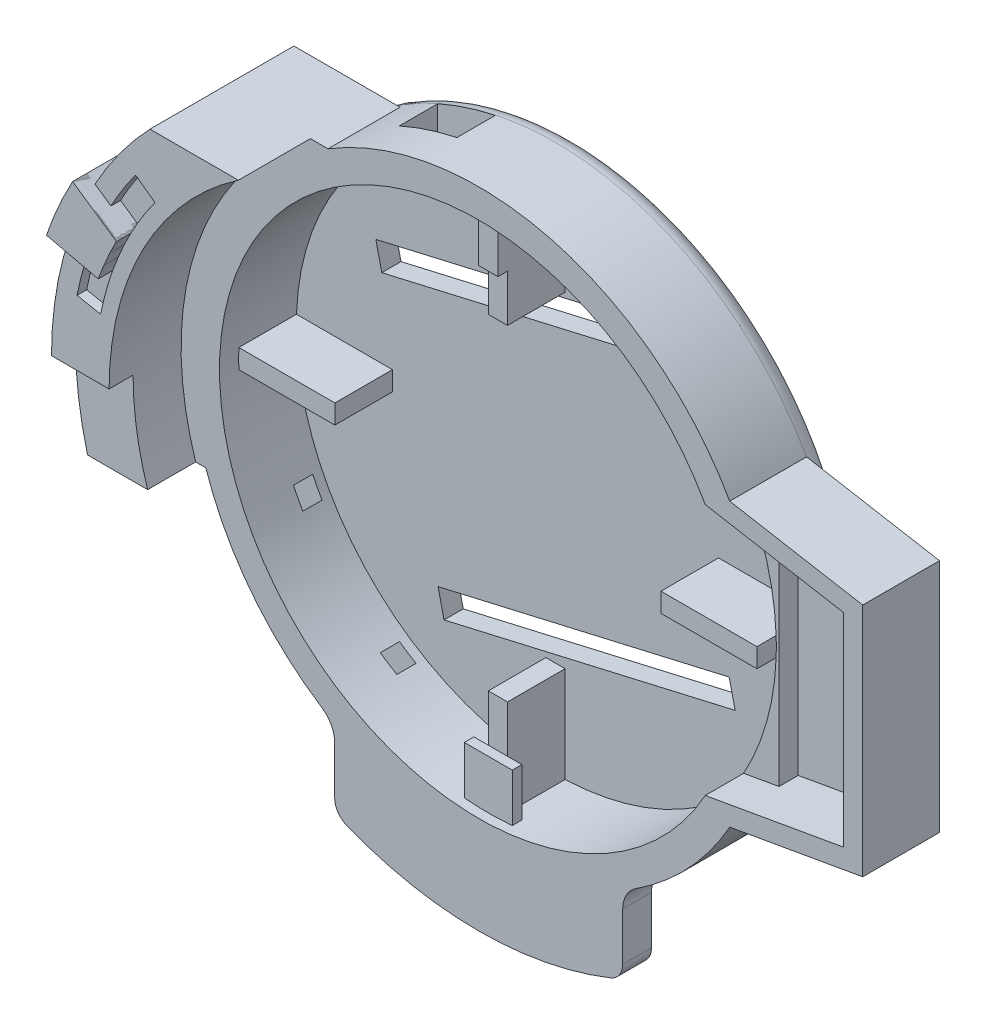
from build123d import *

# Parameters (mm, degrees)
SKETCH_1_R           = 30
EXTRUDE_1_DEPTH      = 2
SKETCH_5_R           = 30
SKETCH_5_R_2         = 27
EXTRUDE_2_DEPTH      = 10
EXTRUDE_START        = -3
EXTRUDE_3_DEPTH      = 3
FILLET_2_R           = 3
FILLET_3_R           = 3
EXTRUDE_START_2      = -6
EXTRUDE_4_DEPTH      = 6
EXTRUDE_6_DEPTH      = 7.5
SKETCH_14_R          = 31
CUT_EXTRUDE_3_DEPTH  = 7.5
CHAMFER_4_SIZE       = 2.644904711
CHAMFER_4_SIZE_2     = 15
CHAMFER_5_SIZE       = 2.644904711
CHAMFER_5_SIZE_2     = 15
CUT_EXTRUDE_START    = -4
CUT_EXTRUDE_6_DEPTH  = 4
EXTRUDE_10_DEPTH     = 5
CUT_EXTRUDE_START_2  = 6
CUT_EXTRUDE_7_DEPTH  = 6
EXTRUDE_11_DEPTH     = 8
EXTRUDE_12_DEPTH     = 1
EXTRUDE_13_DEPTH     = 1.5
EXTRUDE_14_DEPTH     = 16.5
CUT_EXTRUDE_START_3  = -1
CUT_EXTRUDE_8_DEPTH  = 1
EXTRUDE_START_3      = 2
EXTRUDE_15_DEPTH     = 2
CUT_EXTRUDE_9_DEPTH  = 2
SKETCH_33_R          = 30
CUT_EXTRUDE_10_DEPTH = 2
SKETCH_34_R          = 30
EXTRUDE_16_DEPTH     = 2
FILLET_4_R           = 2
FILLET_5_R           = 2
CUT_EXTRUDE_11_DEPTH = 10
FILLET_6_R           = 2
SKETCH_37_W          = 2
SKETCH_37_H          = 2
CUT_EXTRUDE_12_DEPTH = 65
SKETCH_38_W          = 6
SKETCH_38_H          = 4
CUT_EXTRUDE_14_DEPTH = 45


# Some blends are built 0.0001 mm under size
with BuildPart() as part:
    # 草图1 → 凸台-拉伸1 (new body)
    with BuildSketch(Plane.XY):
        Circle(SKETCH_1_R)
    extrude(amount=EXTRUDE_1_DEPTH)

    # 草图5 → 凸台-拉伸2 (add)
    with BuildSketch(Plane.XY.offset(2)):
        Circle(SKETCH_5_R)
        Circle(SKETCH_5_R_2, mode=Mode.SUBTRACT)
    extrude(amount=EXTRUDE_2_DEPTH)

    # 草图6 → 凸台-拉伸3 (add)
    with BuildSketch(Plane.XY.offset(12).offset(EXTRUDE_START)):
        with BuildLine():
            Line((-15, -25.980762114), (-15, -33.980762114))
            ThreePointArc((-15, -33.980762114), (0, -37.144208079), (15, -33.980762114))
            Line((15, -33.980762114), (15, -25.980762114))
            ThreePointArc((15, -25.980762114), (0, -30), (-15, -25.980762114))
        make_face()
    extrude(amount=EXTRUDE_3_DEPTH)

    # 圆角2
    fillet_2_edges = [part.edges().sort_by_distance(p)[0] for p in [
        (-15, -25.980762114, 10.5),
    ]]
    fillet(fillet_2_edges, radius=FILLET_2_R)

    # 圆角3
    fillet_3_edges = [part.edges().sort_by_distance(p)[0] for p in [
        (15, -25.980762114, 10.5),
    ]]
    fillet(fillet_3_edges, radius=FILLET_3_R)

    # 草图8 → 凸台-拉伸4 (add)
    with BuildSketch(Plane.XY.offset(12).offset(EXTRUDE_START_2)):
        with BuildLine():
            Line((26.035573303, -14.90466111), (40, -14.90466111))
            Line((40, -14.90466111), (40, 14.90466111))
            Line((40, 14.90466111), (26.035573303, 14.90466111))
            ThreePointArc((26.035573303, 14.90466111), (30, 0), (26.035573303, -14.90466111))
        make_face()
    extrude(amount=EXTRUDE_4_DEPTH)

    # 草图13 → 凸台-拉伸6 (add, symmetric)
    with BuildSketch(Plane.XY.offset(12)):
        with BuildLine():
            Line((-26.746575291, 25.566006927), (-15.696473801, 25.566006927))
            ThreePointArc((-15.696473801, 25.566006927), (-26.181044804, 14.647624141), (-30, 0))
            Line((-30, 0), (-37, 0))
            ThreePointArc((-37, 0), (-34.341107188, 13.772739637), (-26.746575291, 25.566006927))
        make_face()
    extrude(amount=EXTRUDE_6_DEPTH, both=True)

    # 草图14 → 切除-拉伸3 (cut)
    with BuildSketch(Plane.XY.offset(19.5)):
        Circle(SKETCH_14_R)
    extrude(amount=-CUT_EXTRUDE_3_DEPTH, mode=Mode.SUBTRACT)

    # 倒角4
    # the kernel refuses this chamfer: 15, 2.644904711 mm, written as the material it takes off along each edge
    with BuildSketch(Plane(origin=(40, 14.90466111, -32.978081946), x_dir=(0.21013876076743002, -0.9776715712462589, 0), z_dir=(0, 0, 1))) as chamfer_4_piece_1_section:
        Polygon((CHAMFER_4_SIZE * 0.977671571108, -CHAMFER_4_SIZE * 0.210138760738), (-CHAMFER_4_SIZE_2 * 0.210138760767, -CHAMFER_4_SIZE_2 * 0.977671571246), (0, 0), align=None)
    chamfer_4_piece_1 = extrude(amount=83.956163893, mode=Mode.PRIVATE)
    chamfer_4_piece_1 = chamfer_4_piece_1 - Plane(origin=(0, 0, 9), x_dir=(1, 0, 0), z_dir=(0, 0, -1)) * Cylinder(30, 227, mode=Mode.PRIVATE)
    add(chamfer_4_piece_1, mode=Mode.SUBTRACT)

    # 倒角5
    # the kernel refuses this chamfer: 15, 2.644904711 mm, written as the material it takes off along each edge
    with BuildSketch(Plane(origin=(40, -14.90466111, -32.978081946), x_dir=(0.21013876076743002, 0.9776715712462589, 0), z_dir=(0, 0, 1))) as chamfer_5_piece_1_section:
        Polygon((CHAMFER_5_SIZE * 0.977671571108, CHAMFER_5_SIZE * 0.210138760738), (-CHAMFER_5_SIZE_2 * 0.210138760767, CHAMFER_5_SIZE_2 * 0.977671571246), (0, 0), align=None)
    chamfer_5_piece_1 = extrude(amount=83.956163893, mode=Mode.PRIVATE)
    chamfer_5_piece_1 = chamfer_5_piece_1 - Plane(origin=(0, 0, 9), x_dir=(1, 0, 0), z_dir=(0, 0, -1)) * Cylinder(30, 227, mode=Mode.PRIVATE)
    add(chamfer_5_piece_1, mode=Mode.SUBTRACT)

    # 草图16 → 切除-拉伸6 (cut)
    with BuildSketch(Plane.XY.offset(12).offset(CUT_EXTRUDE_START)):
        with BuildLine():
            ThreePointArc((27, 0), (26.135503138, 6.77757152), (23.59737217, 13.121129016))
            Line((23.59737217, 13.121129016), (18.746765164, 13.976421904))
            Line((18.746765164, 13.976421904), (22.28876202, -13.351872293))
            Line((22.28876202, -13.351872293), (23.59737217, -13.121129016))
            ThreePointArc((23.59737217, -13.121129016), (26.135503138, -6.77757152), (27, 0))
        make_face()
        with BuildLine():
            Line((18.746765164, 13.976421904), (23.59737217, 13.121129016))
            ThreePointArc((23.59737217, 13.121129016), (-27, 0), (23.59737217, -13.121129016))
            Line((23.59737217, -13.121129016), (22.28876202, -13.351872293))
            Line((22.28876202, -13.351872293), (18.746765164, 13.976421904))
        make_face()
        with BuildLine():
            Line((38, 10.581557137), (28.290235639, 12.29365057))
            Line((28.290235639, 12.29365057), (23.59737217, 13.121129016))
            ThreePointArc((23.59737217, 13.121129016), (26.135503138, 6.77757152), (27, 0))
            ThreePointArc((27, 0), (26.135503138, -6.77757152), (23.59737217, -13.121129016))
            Line((23.59737217, -13.121129016), (38, -10.581557137))
            Line((38, -10.581557137), (38, 10.581557137))
        make_face()
    extrude(amount=CUT_EXTRUDE_6_DEPTH, mode=Mode.SUBTRACT)

    # 草图17 → 凸台-拉伸10 (add, symmetric)
    with BuildSketch(Plane.XY.offset(12)):
        with BuildLine():
            Line((-28.430518618, -9.576304669), (-35.739255573, -9.576304669))
            ThreePointArc((-35.739255573, -9.576304669), (-36.683459871, -4.829469112), (-37, 0))
            Line((-37, 0), (-31, 0))
            Line((-31, 0), (-30, 0))
            ThreePointArc((-30, 0), (-29.605029628, -4.852032639), (-28.430518618, -9.576304669))
        make_face()
    extrude(amount=EXTRUDE_10_DEPTH, both=True)

    # 草图18 → 切除-拉伸7 (cut)
    with BuildSketch(Plane.XY.offset(12).offset(CUT_EXTRUDE_START_2)):
        with BuildLine():
            ThreePointArc((-31, 0), (-30.618603506, -4.847795306), (-29.483798753, -9.576304669))
            Line((-29.483798753, -9.576304669), (-28.430518618, -9.576304669))
            ThreePointArc((-28.430518618, -9.576304669), (-29.605029628, -4.852032639), (-30, 0))
            Line((-30, 0), (-31, 0))
        make_face()
    extrude(amount=-CUT_EXTRUDE_7_DEPTH, mode=Mode.SUBTRACT)

    # 草图19 → 凸台-拉伸11 (add)
    with BuildSketch(Plane.XY.offset(2)):
        with BuildLine():
            Line((-1, 26.981475126), (-1, 16.981475126))
            Line((-1, 16.981475126), (1, 16.981475126))
            Line((1, 16.981475126), (1, 26.981475126))
            ThreePointArc((1, 26.981475126), (0, 27), (-1, 26.981475126))
        make_face()
        with BuildLine():
            Line((26.981475126, 1), (16.981475126, 1))
            Line((16.981475126, 1), (16.981475126, -1))
            Line((16.981475126, -1), (26.981475126, -1))
            ThreePointArc((26.981475126, -1), (27, 0), (26.981475126, 1))
        make_face()
        with BuildLine():
            Line((1, -26.981475126), (1, -16.981475126))
            Line((1, -16.981475126), (-1, -16.981475126))
            Line((-1, -16.981475126), (-1, -26.981475126))
            ThreePointArc((-1, -26.981475126), (0, -27), (1, -26.981475126))
        make_face()
        with BuildLine():
            Line((-26.981475126, -1), (-16.981475126, -1))
            Line((-16.981475126, -1), (-16.981475126, 1))
            Line((-16.981475126, 1), (-26.981475126, 1))
            ThreePointArc((-26.981475126, 1), (-27, 0), (-26.981475126, -1))
        make_face()
    extrude(amount=EXTRUDE_11_DEPTH)

    # 草图20 → 凸台-拉伸12 (add)
    with BuildSketch(Plane.XY.offset(10)):
        with BuildLine():
            ThreePointArc((2.5, -26.884010118), (0, -27), (-2.5, -26.884010118))
            Line((-2.5, -26.884010118), (-2.5, -21.884010118))
            Line((-2.5, -21.884010118), (2.5, -21.884010118))
            Line((2.5, -21.884010118), (2.5, -26.884010118))
        make_face()
        with BuildLine():
            ThreePointArc((1, 26.981475126), (0, 27), (-1, 26.981475126))
            Line((-1, 26.981475126), (-1, 21.884010118))
            Line((-1, 21.884010118), (1, 21.884010118))
            Line((1, 21.884010118), (1, 26.981475126))
        make_face()
    extrude(amount=EXTRUDE_12_DEPTH)

    # 草图21 → 凸台-拉伸13 (add)
    with BuildSketch(Plane.XY.offset(19.5)):
        with BuildLine():
            Line((-28.734434843, 15.184935109), (-33.295866493, 18.31352709))
            ThreePointArc((-33.295866493, 18.31352709), (-34.796265088, 15.271540063), (-36.019428995, 12.10787904))
            Line((-36.019428995, 12.10787904), (-30.628781703, 10.868658214))
            ThreePointArc((-30.628781703, 10.868658214), (-29.759963562, 13.061185581), (-28.734434843, 15.184935109))
        make_face()
    extrude(amount=EXTRUDE_13_DEPTH)

    # 草图28 → 切除-拉伸8 (cut)
    with BuildSketch(Plane.XY.offset(19.5).offset(CUT_EXTRUDE_START_3)):
        with BuildLine():
            Line((-34.336052546, 6.784946244), (-31.883477364, 6.300307226))
            ThreePointArc((-31.883477364, 6.300307226), (-31.339481347, 8.60737526), (-30.628781703, 10.868658214))
            Line((-30.628781703, 10.868658214), (-33.080272788, 11.432215546))
            ThreePointArc((-33.080272788, 11.432215546), (-33.788156333, 9.130196691), (-34.336052546, 6.784946244))
        make_face()
        with BuildLine():
            ThreePointArc((-28.734434843, 15.184935109), (-27.551258788, 17.238855508), (-26.22152974, 19.201077524))
            Line((-26.22152974, 19.201077524), (-28.23857049, 20.678083487))
            ThreePointArc((-28.23857049, 20.678083487), (-29.593761465, 18.687142166), (-30.80882562, 16.607717))
            Line((-30.80882562, 16.607717), (-28.734434843, 15.184935109))
        make_face()
    extrude(amount=CUT_EXTRUDE_8_DEPTH, mode=Mode.SUBTRACT)

    # 草图31 → 凸台-拉伸15 (add)
    with BuildSketch(Plane(origin=(0, 0, 6), x_dir=(-1, 0, 0), z_dir=(0, 0, -1)).offset(EXTRUDE_START_3)):
        with BuildLine():
            Line((-40, 12.259756399), (-40, -12.259756399))
            Line((-40, -12.259756399), (-26.150680767, -14.701765044))
            ThreePointArc((-26.150680767, -14.701765044), (-30, 0), (-26.150680767, 14.701765044))
            Line((-26.150680767, 14.701765044), (-40, 12.259756399))
        make_face()
    extrude(amount=-EXTRUDE_15_DEPTH)

    # 草图32 → 切除-拉伸9 (cut)
    with BuildSketch(Plane.XY.offset(8)):
        Polygon((38, -10.581557137), (27.285107826, -12.470881722), (27.285107826, 12.470881722), (38, 10.581557137), align=None)
    extrude(amount=-CUT_EXTRUDE_9_DEPTH, mode=Mode.SUBTRACT)

    # 草图33 → 切除-拉伸10 (cut)
    with BuildSketch(Plane(origin=(0, 0, 0), x_dir=(-1, 0, 0), z_dir=(0, 0, -1))):
        Circle(SKETCH_33_R)
    extrude(amount=-CUT_EXTRUDE_10_DEPTH, mode=Mode.SUBTRACT)

    # 草图34 → 凸台-拉伸16 (add)
    with BuildSketch(Plane(origin=(0, 0, 2), x_dir=(-1, 0, 0), z_dir=(0, 0, -1))):
        Circle(SKETCH_34_R)
    extrude(amount=-EXTRUDE_16_DEPTH)

    # 圆角4
    fillet_4_edges = [part.edges().sort_by_distance(p)[0] for p in [
        (-15, -33.980762114, 10.5),
    ]]
    fillet(fillet_4_edges, radius=FILLET_4_R)

    # 圆角5
    fillet_5_edges = [part.edges().sort_by_distance(p)[0] for p in [
        (15, -33.980762114, 10.5),
    ]]
    fillet(fillet_5_edges, radius=FILLET_5_R)

    # 草图35 → 切除-拉伸11 (cut)
    with BuildSketch(Plane.XY.offset(4)):
        Polygon((-18.713756069, 11.886896156), (11.608940239, 18.887442203), (12.230438934, 16.195435598), (-18.092257374, 9.194889552), align=None)
        Polygon((-12.230438934, -16.195435598), (18.092257374, -9.194889552), (18.713756069, -11.886896156), (-11.608940239, -18.887442203), align=None)
    extrude(amount=-CUT_EXTRUDE_11_DEPTH, mode=Mode.SUBTRACT)

    # 圆角6
    fillet_6_edges = [part.edges().sort_by_distance(p)[0] for p in [
        (-30, 0, 2),
    ]]
    fillet(fillet_6_edges, radius=FILLET_6_R - 0.0001)  # a hair under: the kernel refuses the full size

    # 草图37 → 切除-拉伸12 (cut)
    with BuildSketch(Plane(origin=(7.990737563, 7.990737563, 0), x_dir=(0, 0, 1), z_dir=(-0.7071067811865475, -0.7071067811865476, 0))):
        with Locations((5.93438389, 7.985973932)):
            Rectangle(SKETCH_37_W, SKETCH_37_H)
        with Locations((5.93438389, -5.888371601)):
            Rectangle(SKETCH_37_W, SKETCH_37_H)
    extrude(amount=CUT_EXTRUDE_12_DEPTH, mode=Mode.SUBTRACT)

    # 草图38 → 切除-拉伸14 (cut)
    with BuildSketch(Plane(origin=(0, 0, 0), x_dir=(1, 0, 0), z_dir=(0, 1, 0))):
        with Locations((-9.216767384, -6.051868465)):
            Rectangle(SKETCH_38_W, SKETCH_38_H)
    extrude(amount=CUT_EXTRUDE_14_DEPTH, mode=Mode.SUBTRACT)


with BuildPart() as body_2:
    # 草图26 → 凸台-拉伸14 (new body)
    with BuildSketch(Plane.XY.offset(21)):
        with BuildLine():
            Line((-28.734434843, 15.184935109), (-33.295866493, 18.31352709))
            ThreePointArc((-33.295866493, 18.31352709), (-34.796265088, 15.271540063), (-36.019428995, 12.10787904))
            Line((-36.019428995, 12.10787904), (-30.628781703, 10.868658214))
            ThreePointArc((-30.628781703, 10.868658214), (-29.759963562, 13.061185581), (-28.734434843, 15.184935109))
        make_face()
    extrude(amount=-EXTRUDE_14_DEPTH)


solid = Compound([part.part, body_2.part])
